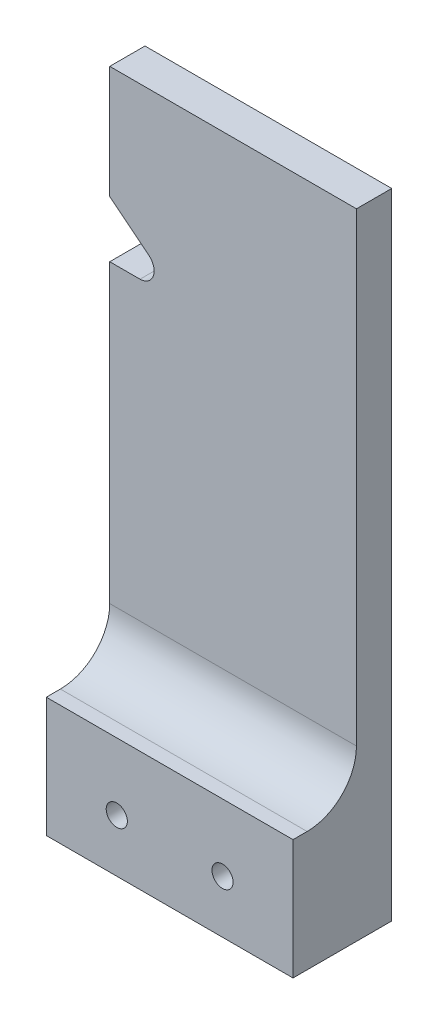
from build123d import *

# Parameters (mm, degrees)
SKETCH_1_W          = 35
SKETCH_1_H          = 90
EXTRUDE_1_DEPTH     = 5
SKETCH_2_W          = 35
SKETCH_2_H          = 17
EXTRUDE_2_DEPTH     = 9
FILLET_1_R          = 7
SKETCH_3_R          = 1.5
CUT_EXTRUDE_3_DEPTH = 51.271761457
CUT_EXTRUDE_4_DEPTH = 51.271761457
FILLET_2_R          = 2


with BuildPart() as part:
    # 草图1 → 凸台-拉伸1 (new body)
    with BuildSketch(Plane.XY):
        Rectangle(SKETCH_1_W, SKETCH_1_H)
    extrude(amount=EXTRUDE_1_DEPTH)

    # 草图2 → 凸台-拉伸2 (add)
    with BuildSketch(Plane.XY.offset(5)):
        with Locations((0, -36.5)):
            Rectangle(SKETCH_2_W, SKETCH_2_H)
    extrude(amount=EXTRUDE_2_DEPTH)

    # 圆角1
    fillet_1_edges = [part.edges().sort_by_distance(p)[0] for p in [
        (0, -28, 5),
    ]]
    fillet(fillet_1_edges, radius=FILLET_1_R)

    # 草图3 → 切除-拉伸3 (cut, through all)
    with BuildSketch(Plane.XY.offset(14)):
        with Locations((-7.5, -37.5)):
            Circle(SKETCH_3_R)
        with Locations((7.5, -37.5)):
            Circle(SKETCH_3_R)
    extrude(amount=-CUT_EXTRUDE_3_DEPTH, mode=Mode.SUBTRACT)

    # 草图4 → 切除-拉伸4 (cut, through all)
    with BuildSketch(Plane(origin=(0, 0, 0), x_dir=(-1, 0, 0), z_dir=(0, 0, -1))):
        Polygon((17.5, 21), (7.5, 21), (17.5, 29), align=None)
    extrude(amount=-CUT_EXTRUDE_4_DEPTH, mode=Mode.SUBTRACT)

    # 圆角2
    fillet_2_edges = [part.edges().sort_by_distance(p)[0] for p in [
        (-7.5, 21, 2.5),
    ]]
    fillet(fillet_2_edges, radius=FILLET_2_R)


solid = part.part
